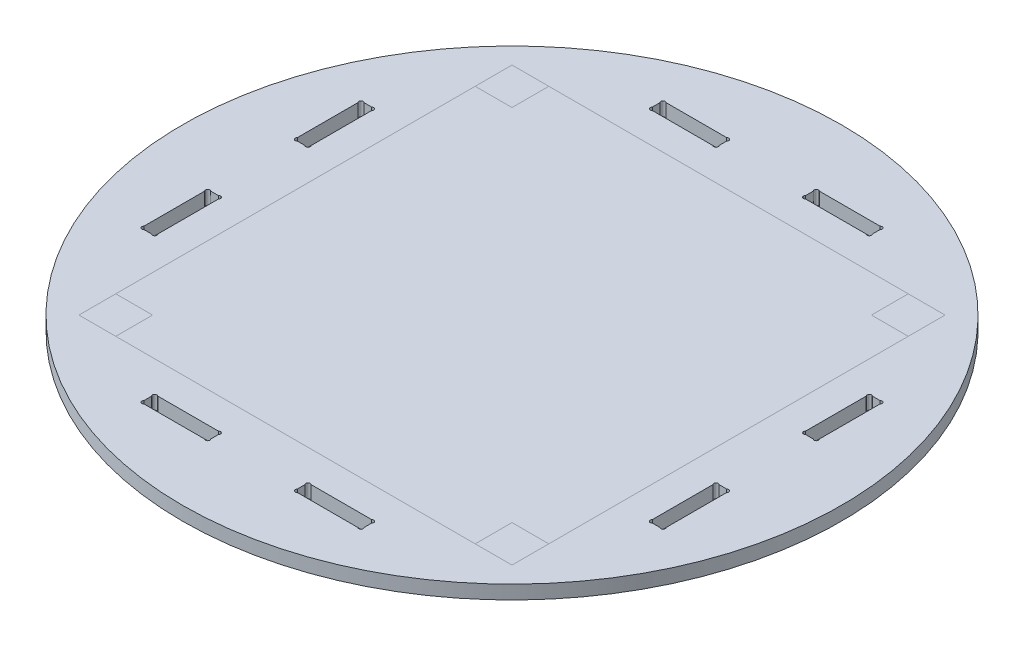
from build123d import *

# Parameters (mm, degrees)
SKETCH1_R                   = 76.1
BOSS_EXTRUDE1_DEPTH         = 3.175
SKETCH3_W                   = 15.4
SKETCH3_H                   = 3.175
CUT_EXTRUDE1_DEPTH          = 108.66847554
SKETCH4_R                   = 0.5
CUT_EXTRUDE2_DEPTH          = 108.66847554
SKETCH_PATTERN1_DEPTH       = 3.175
CIRPATTERN1_COUNT           = 4
CIRPATTERN1_COPY_1_SKETCH_R = 0.5
CIRPATTERN1_COPY_1_DEPTH    = 108.66847554
CIRPATTERN1_COPY_2_SKETCH_R = 0.5
CIRPATTERN1_COPY_2_DEPTH    = 108.66847554
CIRPATTERN1_COPY_3_SKETCH_R = 0.5
CIRPATTERN1_COPY_3_DEPTH    = 108.66847554
CIRPATTERN1_COPY_4_DEPTH    = 3.175
CIRPATTERN1_COPY_5_DEPTH    = 3.175
CIRPATTERN1_COPY_6_DEPTH    = 3.175
SKETCH2_W                   = 100
SKETCH2_H                   = 100
CUT_EXTRUDE3_DEPTH          = 0.0001
SKETCH7_W                   = 8.5
SKETCH7_H                   = 8.5
CUT_EXTRUDE4_DEPTH          = 0.0001


# Read off the part's stored shape, not the designer's step: Sketch-Pattern1
with BuildPart() as part:
    # Sketch1 → Boss-Extrude1 (new body)
    with BuildSketch(Plane(origin=(0, 0, 0), x_dir=(1, 0, 0), z_dir=(0, 1, 0))):
        with Locations(Location((0, 0, 0), (0, 0, 270))):
            Circle(SKETCH1_R)
    extrude(amount=BOSS_EXTRUDE1_DEPTH)

    # Sketch3 → Cut-Extrude1 (cut, symmetric)
    with BuildSketch(Plane(origin=(0, 3.175, 0), x_dir=(1, 0, 0), z_dir=(0, 1, 0))):
        with Locations((-17.7, 58.6875)):
            Rectangle(SKETCH3_W, SKETCH3_H)
        with Locations((17.7, 58.6875)):
            Rectangle(SKETCH3_W, SKETCH3_H)
    cut_extrude1 = extrude(amount=CUT_EXTRUDE1_DEPTH, both=True, mode=Mode.SUBTRACT)

    # Sketch4 → Cut-Extrude2 (cut, symmetric)
    with BuildSketch(Plane(origin=(0, 3.175, 0), x_dir=(1, 0, 0), z_dir=(0, 1, 0))):
        with Locations((-25.046446609, 59.921446609)):
            Circle(SKETCH4_R)
        with Locations((-25.046446609, 57.453553391)):
            Circle(SKETCH4_R)
    cut_extrude2 = extrude(amount=CUT_EXTRUDE2_DEPTH, both=True, mode=Mode.SUBTRACT)

    # Sketch-Pattern1 outline → Sketch-Pattern1 (cut)
    with BuildSketch(Plane(origin=(0, 0, 0), x_dir=(1, 0, 0), z_dir=(0, 1, 0))):
        with BuildLine():
            Line((10, 60.275), (10.707106781, 60.275))
            ThreePointArc((10.707106781, 60.275), (10.353553391, 60.421446609), (10, 60.275))
        make_face()
        with BuildLine():
            Line((10.707106781, 57.1), (10, 57.1))
            ThreePointArc((10, 57.1), (10.353553391, 56.953553391), (10.707106781, 57.1))
        make_face()
        with BuildLine():
            Line((10, 57.1), (10, 57.807106781))
            ThreePointArc((10, 57.807106781), (9.853553391, 57.453553391), (10, 57.1))
        make_face()
        with BuildLine():
            Line((10, 59.567893219), (10, 60.275))
            ThreePointArc((10, 60.275), (9.853553391, 59.921446609), (10, 59.567893219))
        make_face()
    sketch_pattern1 = extrude(amount=SKETCH_PATTERN1_DEPTH, mode=Mode.SUBTRACT)

    # Mirror1: Cut-Extrude2, Sketch-Pattern1 across plane
    add(cut_extrude2.mirror(Plane(origin=(0, 0, 0), x_dir=(0, 0, 1), z_dir=(1, 0, 0))), mode=Mode.SUBTRACT)
    add(sketch_pattern1.mirror(Plane(origin=(0, 0, 0), x_dir=(0, 0, 1), z_dir=(1, 0, 0))), mode=Mode.SUBTRACT)

    # CirPattern1: Cut-Extrude1, Cut-Extrude2, Sketch-Pattern1 ×4 about axis
    cirpattern1_axis = Axis((0, 0, 0), (0, 1, 0))
    add([cut_extrude1.rotate(cirpattern1_axis, i * 360 / CIRPATTERN1_COUNT) for i in range(1, CIRPATTERN1_COUNT)], mode=Mode.SUBTRACT)
    add([cut_extrude2.rotate(cirpattern1_axis, i * 360 / CIRPATTERN1_COUNT) for i in range(1, CIRPATTERN1_COUNT)], mode=Mode.SUBTRACT)
    add([sketch_pattern1.rotate(cirpattern1_axis, i * 360 / CIRPATTERN1_COUNT) for i in range(1, CIRPATTERN1_COUNT)], mode=Mode.SUBTRACT)

    # CirPattern1 copy 1 sketch → CirPattern1 copy 1 (cut, symmetric)
    with BuildSketch(Plane.ZX.offset(3.175)):
        with Locations((-25.046446609, -59.921446609)):
            Circle(CIRPATTERN1_COPY_1_SKETCH_R)
        with Locations((-25.046446609, -57.453553391)):
            Circle(CIRPATTERN1_COPY_1_SKETCH_R)
    extrude(amount=CIRPATTERN1_COPY_1_DEPTH, both=True, mode=Mode.SUBTRACT)

    # CirPattern1 copy 2 sketch → CirPattern1 copy 2 (cut, symmetric)
    with BuildSketch(Plane(origin=(0, 3.175, 0), x_dir=(1, 0, 0), z_dir=(0, 1, 0))):
        with Locations((-25.046446609, -59.921446609)):
            Circle(CIRPATTERN1_COPY_2_SKETCH_R)
        with Locations((-25.046446609, -57.453553391)):
            Circle(CIRPATTERN1_COPY_2_SKETCH_R)
    extrude(amount=CIRPATTERN1_COPY_2_DEPTH, both=True, mode=Mode.SUBTRACT)

    # CirPattern1 copy 3 sketch → CirPattern1 copy 3 (cut, symmetric)
    with BuildSketch(Plane(origin=(0, 3.175, 0), x_dir=(0, 0, -1), z_dir=(0, 1, 0))):
        with Locations((-25.046446609, -59.921446609)):
            Circle(CIRPATTERN1_COPY_3_SKETCH_R)
        with Locations((-25.046446609, -57.453553391)):
            Circle(CIRPATTERN1_COPY_3_SKETCH_R)
    extrude(amount=CIRPATTERN1_COPY_3_DEPTH, both=True, mode=Mode.SUBTRACT)

    # CirPattern1 copy 4 sketch → CirPattern1 copy 4 (cut)
    with BuildSketch(Plane.ZX):
        with BuildLine():
            Line((10, -60.275), (10.707106781, -60.275))
            ThreePointArc((10.707106781, -60.275), (10.353553391, -60.421446609), (10, -60.275))
        make_face()
        with BuildLine():
            Line((10.707106781, -57.1), (10, -57.1))
            ThreePointArc((10, -57.1), (10.353553391, -56.953553391), (10.707106781, -57.1))
        make_face()
        with BuildLine():
            Line((10, -57.1), (10, -57.807106781))
            ThreePointArc((10, -57.807106781), (9.853553391, -57.453553391), (10, -57.1))
        make_face()
        with BuildLine():
            Line((10, -59.567893219), (10, -60.275))
            ThreePointArc((10, -60.275), (9.853553391, -59.921446609), (10, -59.567893219))
        make_face()
    extrude(amount=CIRPATTERN1_COPY_4_DEPTH, mode=Mode.SUBTRACT)

    # CirPattern1 copy 5 sketch → CirPattern1 copy 5 (cut)
    with BuildSketch(Plane(origin=(0, 0, 0), x_dir=(1, 0, 0), z_dir=(0, 1, 0))):
        with BuildLine():
            Line((10, -60.275), (10.707106781, -60.275))
            ThreePointArc((10.707106781, -60.275), (10.353553391, -60.421446609), (10, -60.275))
        make_face()
        with BuildLine():
            Line((10.707106781, -57.1), (10, -57.1))
            ThreePointArc((10, -57.1), (10.353553391, -56.953553391), (10.707106781, -57.1))
        make_face()
        with BuildLine():
            Line((10, -57.1), (10, -57.807106781))
            ThreePointArc((10, -57.807106781), (9.853553391, -57.453553391), (10, -57.1))
        make_face()
        with BuildLine():
            Line((10, -59.567893219), (10, -60.275))
            ThreePointArc((10, -60.275), (9.853553391, -59.921446609), (10, -59.567893219))
        make_face()
    extrude(amount=CIRPATTERN1_COPY_5_DEPTH, mode=Mode.SUBTRACT)

    # CirPattern1 copy 6 sketch → CirPattern1 copy 6 (cut)
    with BuildSketch(Plane(origin=(0, 0, 0), x_dir=(0, 0, -1), z_dir=(0, 1, 0))):
        with BuildLine():
            Line((10, -60.275), (10.707106781, -60.275))
            ThreePointArc((10.707106781, -60.275), (10.353553391, -60.421446609), (10, -60.275))
        make_face()
        with BuildLine():
            Line((10.707106781, -57.1), (10, -57.1))
            ThreePointArc((10, -57.1), (10.353553391, -56.953553391), (10.707106781, -57.1))
        make_face()
        with BuildLine():
            Line((10, -57.1), (10, -57.807106781))
            ThreePointArc((10, -57.807106781), (9.853553391, -57.453553391), (10, -57.1))
        make_face()
        with BuildLine():
            Line((10, -59.567893219), (10, -60.275))
            ThreePointArc((10, -60.275), (9.853553391, -59.921446609), (10, -59.567893219))
        make_face()
    extrude(amount=CIRPATTERN1_COPY_6_DEPTH, mode=Mode.SUBTRACT)

    # Sketch2 → Cut-Extrude3 (cut)
    with BuildSketch(Plane(origin=(0, 3.175, 0), x_dir=(1, 0, 0), z_dir=(0, 1, 0))):
        Rectangle(SKETCH2_W, SKETCH2_H)
    extrude(amount=-CUT_EXTRUDE3_DEPTH, mode=Mode.SUBTRACT)

    # Sketch7 → Cut-Extrude4 (cut)
    with BuildSketch(Plane(origin=(0, 3.1749, 0), x_dir=(1, 0, 0), z_dir=(0, 1, 0))):
        with Locations((-45.75, 45.75)):
            Rectangle(SKETCH7_W, SKETCH7_H)
        with Locations((45.75, 45.75)):
            Rectangle(SKETCH7_W, SKETCH7_H)
        with Locations((45.75, -45.75)):
            Rectangle(SKETCH7_W, SKETCH7_H)
        with Locations((-45.75, -45.75)):
            Rectangle(SKETCH7_W, SKETCH7_H)
    extrude(amount=-CUT_EXTRUDE4_DEPTH, mode=Mode.SUBTRACT)


solid = part.part
